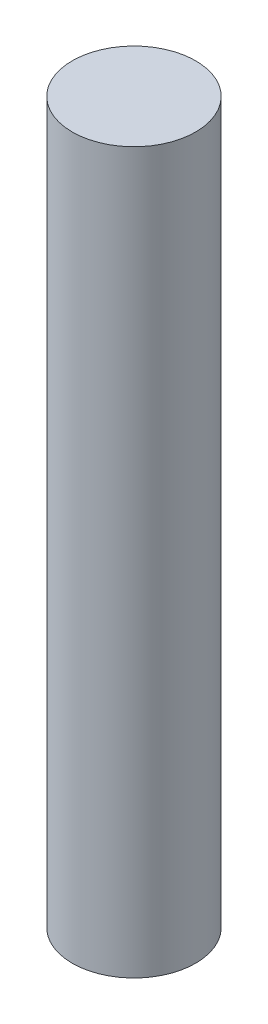
from build123d import *

# Parameters (mm, degrees)
CROQUIS2_R              = 2.4
SALIENTE_EXTRUIR1_DEPTH = 14


with BuildPart() as part:
    # Croquis2 → Saliente-Extruir1 (new, symmetric)
    with BuildSketch(Plane(origin=(0, 0, 0), x_dir=(1, 0, 0), z_dir=(0, 1, 0))):
        Circle(CROQUIS2_R)
    extrude(amount=SALIENTE_EXTRUIR1_DEPTH, both=True)


solid = part.part
